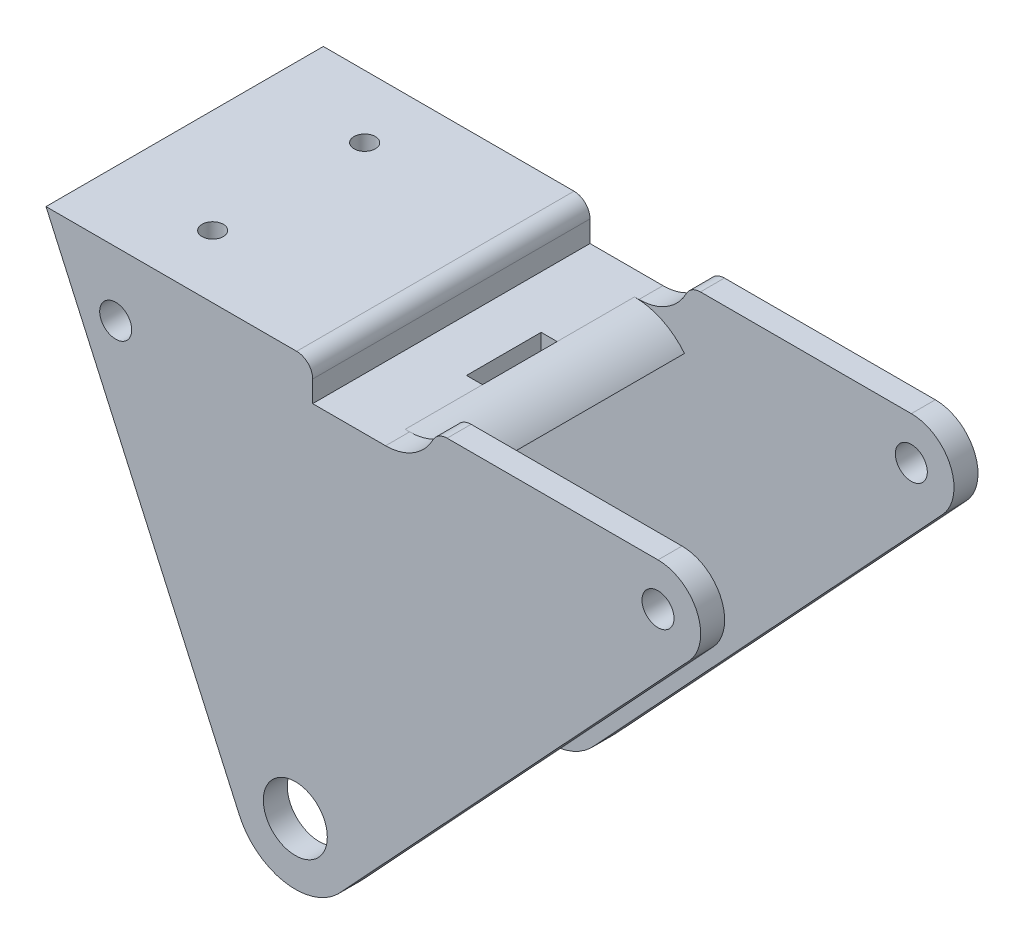
from build123d import *

# Parameters (mm, degrees)
RESSALTO_EXTRUS_O1_DEPTH      = 26
RESSALTO_EXTRUS_O1_DEPTH_BACK = 26
ESBO_O10_R                    = 6
ESBO_O10_R_2                  = 3
CASCA1_START                  = -21.5
CASCA1_OUTLINE_R              = 10.5
CASCA1_DEPTH                  = 43
CORTE_EXTRUS_O1_DEPTH         = 111.580287574
CORTE_EXTRUS_O1_DEPTH_BACK    = 111.580287574
ESBO_O12_W                    = 43
ESBO_O12_H                    = 35.359478928
FILETE3_R                     = 9
ESBO_O17_W                    = 71.509931374
ESBO_O17_H                    = 43
CORTE_EXTRUS_O6_DEPTH         = 20
FILETE7_R                     = 3
FILETE8_R                     = 3
FILETE9_R                     = 12
ESBO_O18_W                    = 3
ESBO_O18_H                    = 14
CORTE_EXTRUS_O7_DEPTH         = 10
CORTE_EXTRUS_O8_DEPTH         = 120.398492453
CORTE_EXTRUS_O8_DEPTH_BACK    = 120.398492453
ESBO_O19_R                    = 3
FILETE10_R                    = 10
ESBO_O20_R                    = 2
CORTE_EXTRUS_O10_DEPTH        = 10


# Read off the part's stored shape, not the designer's step: Casca1
with BuildPart() as part:
    # Esboço10 → Ressalto-extrusão1 (new, two sides: drawn at the far end of the back side and taken through both)
    with BuildSketch(Plane.XY.offset(-RESSALTO_EXTRUS_O1_DEPTH_BACK)):
        with BuildLine():
            Line((8.831023296, -7.34936003), (73.857380106, 62.551046129))
            ThreePointArc((73.857380106, 62.551046129), (75.334563074, 71.194398928), (68, 76))
            Line((68, 76), (25.460219944, 76))
            Line((25.460219944, 76), (25.460219944, 69))
            Line((25.460219944, 69), (3.255321751, 69))
            Line((3.255321751, 69), (3.255321751, 76))
            Line((3.255321751, 76), (-46.744678249, 76))
            Line((-46.744678249, 76), (-10.47981176, -4.708886362))
            ThreePointArc((-10.47981176, -4.708886362), (-1.556486796, -11.383207552), (8.831023296, -7.34936003))
        make_face()
        Circle(ESBO_O10_R, mode=Mode.SUBTRACT)
        with Locations((68, 68)):
            Circle(ESBO_O10_R_2, mode=Mode.SUBTRACT)
    extrude(amount=RESSALTO_EXTRUS_O1_DEPTH + RESSALTO_EXTRUS_O1_DEPTH_BACK)

    # Casca1 outline → Casca1 (cut)
    with BuildSketch(Plane.XY.offset(CASCA1_START)):
        with BuildLine():
            Line((8.831023296, -7.34936003), (73.857380106, 62.551046129))
            Line((73.857380106, 62.551046129), (73.491293849, 62.891605746))
            ThreePointArc((73.491293849, 62.891605746), (63.658096197, 61.884620096), (61.366750419, 71.5))
            Line((61.366750419, 71.5), (29.960219944, 71.5))
            Line((29.960219944, 71.5), (29.960219944, 64.5))
            Line((29.960219944, 64.5), (-1.244678249, 64.5))
            Line((-1.244678249, 64.5), (-1.244678249, 71.5))
            Line((-1.244678249, 71.5), (-44.722696451, 71.5))
            Line((-44.722696451, 71.5), (-10.47981176, -4.708886362))
            ThreePointArc((-10.47981176, -4.708886362), (-1.556486796, -11.383207552), (8.831023296, -7.34936003))
        make_face()
        Circle(CASCA1_OUTLINE_R, mode=Mode.SUBTRACT)
    extrude(amount=CASCA1_DEPTH, mode=Mode.SUBTRACT)

    # Esboço12 → Corte-extrusão1 (cut, two sides: drawn at the far end of the back side and taken through both)
    with BuildSketch(Plane(origin=(0, 0, 0), x_dir=(0, 0, -1), z_dir=(1, 0, 0)).offset(-CORTE_EXTRUS_O1_DEPTH_BACK)):
        Rectangle(ESBO_O12_W, ESBO_O12_H)
    extrude(amount=CORTE_EXTRUS_O1_DEPTH + CORTE_EXTRUS_O1_DEPTH_BACK, mode=Mode.SUBTRACT)

    # Filete3
    # the kernel refuses this fillet: 9 mm, written as the material it takes off along each edge
    with BuildSketch(Plane(origin=(-1.244678249, 64.5, -21.5), x_dir=(0, 1, 0), z_dir=(0, 0, 1))) as filete3_piece_1:
        with BuildLine():
            CenterArc((9, -8.774964387), FILETE3_R, 102.839588407, 77.160411593)
            Line((0, -8.774964387), (0, 0))
            Line((0, 0), (7, 0))
        make_face()
    extrude(amount=43, mode=Mode.SUBTRACT)

    # Esboço17 → Corte-extrusão6 (cut)
    with BuildSketch(Plane(origin=(0, 76, 0), x_dir=(1, 0, 0), z_dir=(0, 1, 0))):
        with Locations((61.215185631, 0)):
            Rectangle(ESBO_O17_W, ESBO_O17_H)
    extrude(amount=-CORTE_EXTRUS_O6_DEPTH, mode=Mode.SUBTRACT)

    # Filete7
    filete7_edges = [part.edges().sort_by_distance(p)[0] for p in [
        (25.460219944, 76, 23.75),
        (25.460219944, 76, -23.75),
    ]]
    fillet(filete7_edges, radius=FILETE7_R)

    # Filete8
    filete8_edges = [part.edges().sort_by_distance(p)[0] for p in [
        (3.255321751, 76, 0),
    ]]
    fillet(filete8_edges, radius=FILETE8_R)

    # Filete9
    # the kernel refuses this fillet: 12 mm, written as the material it takes off along each edge
    with BuildSketch(Plane(origin=(25.460219944, 69, -21.5), x_dir=(-1, 0, 0), z_dir=(0, 0, 1))) as filete9_piece_1:
        with BuildLine():
            CenterArc((9.367496998, 12), FILETE9_R, 218.682187453, 51.317812547)
            Line((0, 4.5), (0, 0))
            Line((0, 0), (9.367496998, 0))
        make_face()
    extrude(amount=43, mode=Mode.SUBTRACT)

    # Esboço18 → Corte-extrusão7 (cut)
    with BuildSketch(Plane(origin=(0, 69, 0), x_dir=(1, 0, 0), z_dir=(0, 1, 0))):
        with Locations((14.592722946, 0)):
            Rectangle(ESBO_O18_W, ESBO_O18_H)
    extrude(amount=-CORTE_EXTRUS_O7_DEPTH, mode=Mode.SUBTRACT)

    # Esboço19 → Corte-extrusão8 (cut, two sides: drawn at the far end of the back side and taken through both)
    with BuildSketch(Plane.XY.offset(26).offset(-CORTE_EXTRUS_O8_DEPTH_BACK)):
        with Locations((-33.678552977, 64)):
            Circle(ESBO_O19_R)
    extrude(amount=CORTE_EXTRUS_O8_DEPTH + CORTE_EXTRUS_O8_DEPTH_BACK, mode=Mode.SUBTRACT)

    # Filete10
    filete10_edges = [part.edges().sort_by_distance(p)[0] for p in [
        (25.460219944, 69, -23.75),
        (25.460219944, 69, 23.75),
    ]]
    fillet(filete10_edges, radius=FILETE10_R)

    # Esboço20 → Corte-extrusão10 (cut)
    with BuildSketch(Plane(origin=(0, 76, 0), x_dir=(1, 0, 0), z_dir=(0, 1, 0))):
        with Locations(Location((-27.244678249, 14.25, 0), (0, 0, 180))):
            Circle(ESBO_O20_R)
        with Locations(Location((-27.244678249, -14.25, 0), (0, 0, 180))):
            Circle(ESBO_O20_R)
    extrude(amount=-CORTE_EXTRUS_O10_DEPTH, mode=Mode.SUBTRACT)


solid = part.part
